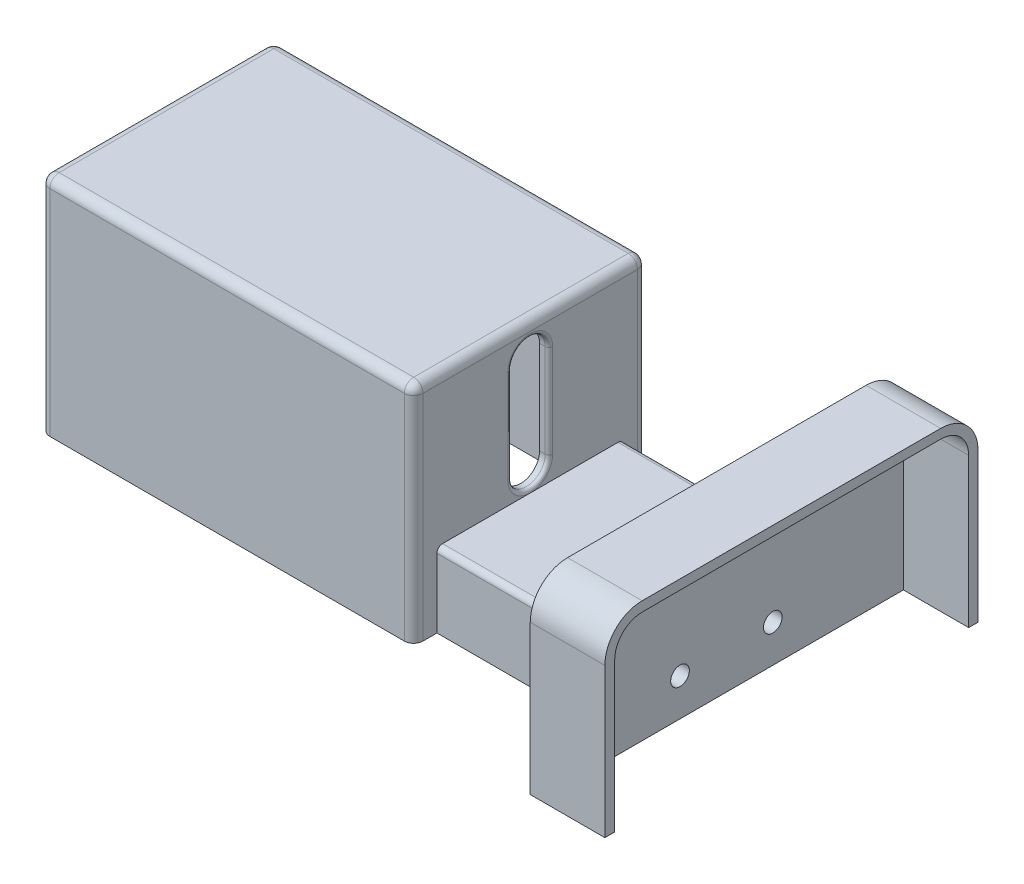
from build123d import *

# Parameters (mm, degrees)
SKETCH1_W           = 200
SKETCH1_H           = 125
BOSS_EXTRUDE1_DEPTH = 120
BOSS_EXTRUDE2_DEPTH = 120
SKETCH3_W           = 200
SKETCH3_H           = 125
CUT_EXTRUDE1_DEPTH  = 120
FILLET1_R           = 5
SKETCH4_W           = 100
SKETCH4_H           = 40
BOSS_EXTRUDE3_DEPTH = 100
FILLET3_R           = 3
SKETCH5_W           = 190
SKETCH5_H           = 115
CUT_EXTRUDE2_DEPTH  = 115
SKETCH6_W           = 15
SKETCH6_H           = 15
BOSS_EXTRUDE4_DEPTH = 110
SKETCH7_W           = 200
SKETCH7_H           = 100
BOSS_EXTRUDE5_DEPTH = 40
FILLET4_R           = 20
SKETCH9_W           = 189.724209099
SKETCH9_H           = 80
CUT_EXTRUDE9_DEPTH  = 35
CUT_EXTRUDE10_DEPTH = 35
CUT_EXTRUDE11_DEPTH = 20
FILLET5_R           = 2
SKETCH11_R          = 5
CUT_EXTRUDE12_DEPTH = 132


with BuildPart() as part:
    # Sketch1 → Boss-Extrude1 (new body)
    with BuildSketch(Plane(origin=(0, 0, 0), x_dir=(1, 0, 0), z_dir=(0, 1, 0))):
        with Locations((8.778519755, -18.055555556)):
            Rectangle(SKETCH1_W, SKETCH1_H)
    extrude(amount=BOSS_EXTRUDE1_DEPTH)

    # Sketch2 → Boss-Extrude2 (add)
    with BuildSketch(Plane(origin=(0, 120, 0), x_dir=(1, 0, 0), z_dir=(0, 1, 0))):
        with BuildLine():
            Line((-86.221480245, 44.444444444), (103.778519755, 44.444444444))
            ThreePointArc((103.778519755, 44.444444444), (107.314053661, 42.97997835), (108.778519755, 39.444444444))
            Line((108.778519755, 39.444444444), (108.778519755, -75.555555556))
            ThreePointArc((108.778519755, -75.555555556), (107.314053661, -79.091089461), (103.778519755, -80.555555556))
            Line((103.778519755, -80.555555556), (-86.221480245, -80.555555556))
            ThreePointArc((-86.221480245, -80.555555556), (-89.757014151, -79.091089461), (-91.221480245, -75.555555556))
            Line((-91.221480245, -75.555555556), (-91.221480245, 39.444444444))
            ThreePointArc((-91.221480245, 39.444444444), (-89.757014151, 42.97997835), (-86.221480245, 44.444444444))
        make_face()
    extrude(amount=BOSS_EXTRUDE2_DEPTH)

    # Sketch3 → Cut-Extrude1 (cut)
    with BuildSketch(Plane(origin=(0, 0, 0), x_dir=(-1, 0, 0), z_dir=(0, -1, 0))):
        with Locations((-8.778519755, -18.055555556)):
            Rectangle(SKETCH3_W, SKETCH3_H)
    extrude(amount=-CUT_EXTRUDE1_DEPTH, mode=Mode.SUBTRACT)

    # Fillet1
    fillet1_edges = [part.edges().sort_by_distance(p)[0] for p in [
        (-89.757014151, 240, -42.97997835),
        (-91.221480245, 240, 18.055555556),
        (-89.757014151, 240, 79.091089461),
        (8.778519755, 240, 80.555555556),
        (107.314053661, 240, 79.091089461),
        (108.778519755, 240, 18.055555556),
        (107.314053661, 240, -42.97997835),
        (8.778519755, 240, -44.444444444),
    ]]
    fillet(fillet1_edges, radius=FILLET1_R)

    # Sketch4 → Boss-Extrude3 (add)
    with BuildSketch(Plane(origin=(108.778519755, 0, 0), x_dir=(0, 0, -1), z_dir=(1, 0, 0))):
        with Locations((-18.055555556, 140)):
            Rectangle(SKETCH4_W, SKETCH4_H)
    extrude(amount=BOSS_EXTRUDE3_DEPTH)

    # Fillet3
    fillet3_edges = [part.edges().sort_by_distance(p)[0] for p in [
        (158.778519755, 160, 68.055555556),
        (158.778519755, 160, -31.944444444),
    ]]
    fillet(fillet3_edges, radius=FILLET3_R)

    # Sketch5 → Cut-Extrude2 (cut)
    with BuildSketch(Plane(origin=(0, 120, 0), x_dir=(-1, 0, 0), z_dir=(0, -1, 0))):
        with Locations((-8.778519755, -18.055555556)):
            Rectangle(SKETCH5_W, SKETCH5_H)
    extrude(amount=-CUT_EXTRUDE2_DEPTH, mode=Mode.SUBTRACT)

    # Sketch6 → Boss-Extrude4 (add)
    with BuildSketch(Plane(origin=(0, 235, 0), x_dir=(-1, 0, 0), z_dir=(0, -1, 0))):
        with Locations((78.721480245, -68.055555556)):
            Rectangle(SKETCH6_W, SKETCH6_H)
        with Locations((-96.278519755, -68.055555556)):
            Rectangle(SKETCH6_W, SKETCH6_H)
        with Locations((-96.278519755, 31.944444444)):
            Rectangle(SKETCH6_W, SKETCH6_H)
        with Locations((78.721480245, 31.944444444)):
            Rectangle(SKETCH6_W, SKETCH6_H)
    extrude(amount=BOSS_EXTRUDE4_DEPTH)

    # Sketch7 → Boss-Extrude5 (add)
    with BuildSketch(Plane(origin=(208.778519755, 0, 0), x_dir=(0, 0, -1), z_dir=(1, 0, 0))):
        with Locations((-18.055555556, 170)):
            Rectangle(SKETCH7_W, SKETCH7_H)
    extrude(amount=BOSS_EXTRUDE5_DEPTH)

    # Fillet4
    fillet4_edges = [part.edges().sort_by_distance(p)[0] for p in [
        (228.778519755, 220, 118.055555556),
        (228.778519755, 220, -81.944444444),
    ]]
    fillet(fillet4_edges, radius=FILLET4_R)

    # Sketch9 → Cut-Extrude9 (cut)
    with BuildSketch(Plane(origin=(248.778519755, 0, 0), x_dir=(0, 0, -1), z_dir=(1, 0, 0))):
        with Locations((-17.917660106, 160)):
            Rectangle(SKETCH9_W, SKETCH9_H)
    extrude(amount=-CUT_EXTRUDE9_DEPTH, mode=Mode.SUBTRACT)

    # Sketch9<3> → Cut-Extrude10 (cut)
    with BuildSketch(Plane(origin=(248.778519755, 0, 0), x_dir=(0, 0, -1), z_dir=(1, 0, 0))):
        with BuildLine():
            Line((-112.779764655, 200), (76.944444444, 200))
            ThreePointArc((76.944444444, 200), (72.551046162, 210.606601718), (61.944444444, 215))
            Line((61.944444444, 215), (-98.055555556, 214.7242091))
            ThreePointArc((-98.055555556, 214.7242091), (-108.467143658, 210.411588102), (-112.779764655, 200))
        make_face()
    extrude(amount=-CUT_EXTRUDE10_DEPTH, mode=Mode.SUBTRACT)

    # Sketch10 → Cut-Extrude11 (cut)
    with BuildSketch(Plane(origin=(108.778519755, 0, 0), x_dir=(0, 0, -1), z_dir=(1, 0, 0))):
        with BuildLine():
            Line((-28.055555556, 222), (-28.055555556, 172))
            ThreePointArc((-28.055555556, 172), (-18.055555556, 162), (-8.055555556, 172))
            Line((-8.055555556, 172), (-8.055555556, 222))
            ThreePointArc((-8.055555556, 222), (-18.055555556, 232), (-28.055555556, 222))
        make_face()
    extrude(amount=-CUT_EXTRUDE11_DEPTH, mode=Mode.SUBTRACT)

    # Fillet5
    fillet5_edges = [part.edges().sort_by_distance(p)[0] for p in [
        (108.778519755, 232, 18.055555556),
        (108.778519755, 197, 28.055555556),
        (108.778519755, 162, 18.055555556),
        (108.778519755, 197, 8.055555556),
    ]]
    fillet(fillet5_edges, radius=FILLET5_R - 0.0001)  # a hair under: the kernel refuses the full size

    # Sketch11 → Cut-Extrude12 (cut)
    with BuildSketch(Plane(origin=(213.778519755, 0, 0), x_dir=(0, 0, -1), z_dir=(1, 0, 0))):
        with Locations((-42.779764655, 140)):
            Circle(SKETCH11_R)
        with Locations((6.944444444, 140)):
            Circle(SKETCH11_R)
    extrude(amount=-CUT_EXTRUDE12_DEPTH, mode=Mode.SUBTRACT)


solid = part.part
